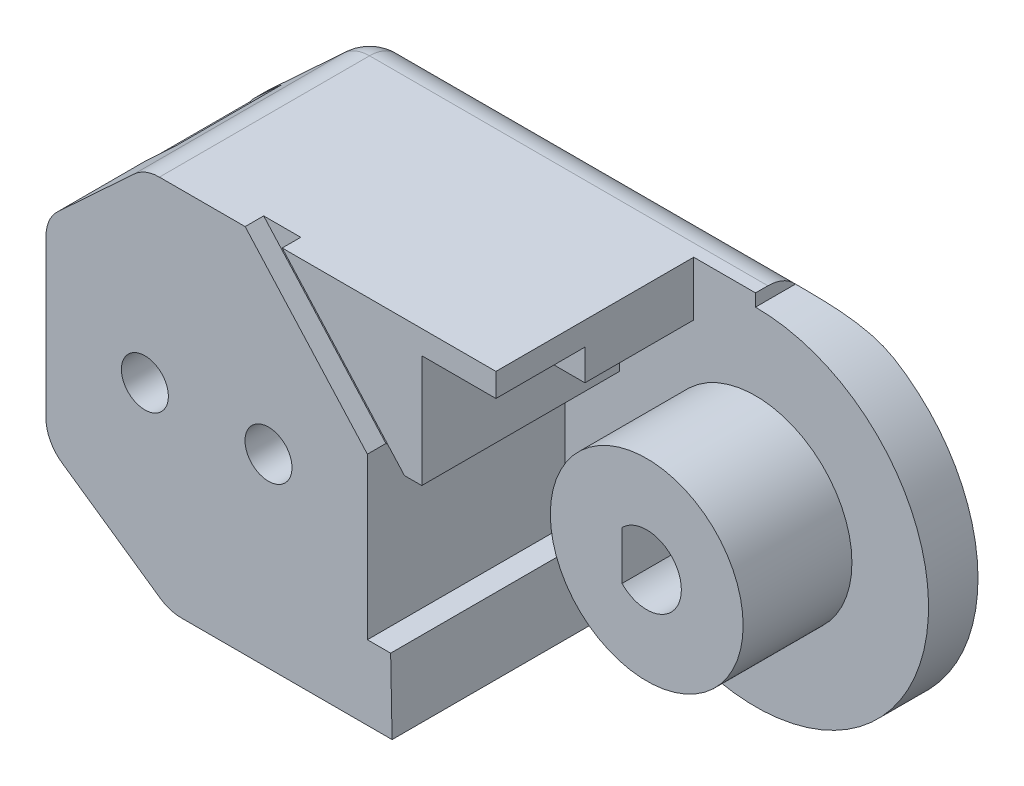
from build123d import *

# Parameters (mm, degrees)
BOSS_EXTRUDE1_DEPTH = 2
BOSS_EXTRUDE2_DEPTH = 8
SKETCH24_R          = 3.9
BOSS_EXTRUDE5_DEPTH = 4.4
SKETCH30_W          = 4.40861202
SKETCH30_H          = 1.324178481
CUT_EXTRUDE12_DEPTH = 16
CUT_EXTRUDE11_DEPTH = 23.928148639
FILLET1_R           = 1.5
SKETCH34_W          = 1.5
SKETCH34_H          = 1.5
CUT_EXTRUDE13_DEPTH = 8
SKETCH36_R          = 0.95
CUT_EXTRUDE15_DEPTH = 8
SKETCH37_R          = 2
CUT_EXTRUDE16_DEPTH = 4.5
SKETCH38_W          = 3
SKETCH38_H          = 1.25
CUT_EXTRUDE17_DEPTH = 3.6


with BuildPart() as part:
    # Sketch2 → Boss-Extrude1 (new body)
    with BuildSketch(Plane.XY):
        with BuildLine():
            Line((-2.5, 7.5), (-16.7, 7.5))
            Line((-16.7, 7.5), (-20.7, 3.793442666))
            Line((-20.7, 3.793442666), (-20.7, -4.031648778))
            Line((-20.7, -4.031648778), (-15.7, -7.5))
            Line((-15.7, -7.5), (-6.7, -7.5))
            Line((-6.7, -7.5), (-4.2, -5.6))
            ThreePointArc((-4.2, -5.6), (3.130495168, -6.260990337), (7, 0))
            ThreePointArc((7, 0), (4.949747468, 4.949747468), (0, 7))
            Line((0, 7), (0, 7.5))
            Line((0, 7.5), (-2.5, 7.5))
        make_face()
    extrude(amount=BOSS_EXTRUDE1_DEPTH)

    # Sketch4 → Boss-Extrude2 (add)
    with BuildSketch(Plane.XY.offset(2)):
        Polygon((-15.7, -7.5), (-6.7, -7.5), (-6.759079174, -4.5), (-7.7, -4.5), (-7.7, 2), (-5.5, 2), (-5.5, 5.3), (-2.5, 5.3), (-2.5, 7.5), (-16.7, 7.5), (-20.7, 3.793442666), (-20.7, -4.031648778), align=None)
    extrude(amount=BOSS_EXTRUDE2_DEPTH)

    # Sketch24 → Boss-Extrude5 (add)
    with BuildSketch(Plane.XY.offset(2)):
        Circle(SKETCH24_R)
    extrude(amount=BOSS_EXTRUDE5_DEPTH)

    # Sketch30 → Cut-Extrude12 (cut)
    with BuildSketch(Plane(origin=(-5.5, 0, 0), x_dir=(0, 0, -1), z_dir=(1, 0, 0))):
        with Locations((-4.20430601, 4.63791076)):
            Rectangle(SKETCH30_W, SKETCH30_H)
    extrude(amount=-CUT_EXTRUDE12_DEPTH, mode=Mode.SUBTRACT)

    # Sketch28 → Cut-Extrude11 (cut, through all)
    with BuildSketch(Plane.XY.offset(6.4)):
        with BuildLine():
            Line((-1, 0.979795897), (-1, -0.979795897))
            ThreePointArc((-1, -0.979795897), (1.4, 0), (-1, 0.979795897))
        make_face()
    extrude(amount=-CUT_EXTRUDE11_DEPTH, mode=Mode.SUBTRACT)

    # Fillet1
    # the kernel refuses this fillet: 1.5 mm, written as the material it takes off along each edge
    with BuildSketch(Plane(origin=(-15.230677435, -6, 1.5), x_dir=(-0.5699665637840448, -0.8216678867816415, 0), z_dir=(0, 0, -1))) as fillet1_piece_1_section:
        Polygon((0, 0), (FILLET1_R * 1.02, 0), (FILLET1_R * 1.02, -FILLET1_R * 0.319139344377), (FILLET1_R * 0.838101244517, -FILLET1_R * 0.58136589506), align=None)
    fillet1_piece_1 = extrude(amount=FILLET1_R * 1.02, mode=Mode.PRIVATE)
    fillet1_piece_1 = fillet1_piece_1 - Plane(origin=(-15.230677435, -6, 1.5), x_dir=(0.29860685961507855, 0.9543762064253388, 0), z_dir=(0, 0, -1)) * Sphere(FILLET1_R, mode=Mode.PRIVATE)
    add(fillet1_piece_1, mode=Mode.SUBTRACT)
    with BuildSketch(Plane(origin=(-16.11186344, 6, 1.5), x_dir=(-0.6796897201843015, 0.7334997506991983, 0), z_dir=(0, 0, -1))) as fillet1_piece_2_section:
        Polygon((0, 0), (FILLET1_R * 1.02, 0), (FILLET1_R * 1.02, FILLET1_R * 0.399932860855), (FILLET1_R * 0.748169745713, FILLET1_R * 0.693283514588), align=None)
    fillet1_piece_2 = extrude(amount=FILLET1_R * 1.02, mode=Mode.PRIVATE)
    fillet1_piece_2 = fillet1_piece_2 - Plane(origin=(-16.11186344, 6, 1.5), x_dir=(0.3650344157067945, -0.9309940254102596, 0), z_dir=(0, 0, -1)) * Sphere(FILLET1_R, mode=Mode.PRIVATE)
    add(fillet1_piece_2, mode=Mode.SUBTRACT)
    with BuildSketch(Plane(origin=(-19.2, 3.138411196, 1.5), x_dir=(-0.6796897201843015, 0.7334997506991983, 0), z_dir=(0, 0, -1))) as fillet1_piece_3_section:
        Polygon((0, 0), (FILLET1_R * 1.02, 0), (FILLET1_R * 1.02, -FILLET1_R * 0.445421399395), (FILLET1_R * 0.693283514588, -FILLET1_R * 0.748169745713), align=None)
    fillet1_piece_3 = extrude(amount=FILLET1_R * 1.02, mode=Mode.PRIVATE)
    fillet1_piece_3 = fillet1_piece_3 - Plane(origin=(-19.2, 3.138411196, 1.5), x_dir=(0.9164304993244992, -0.40019387789901173, 0), z_dir=(0, 0, -1)) * Sphere(FILLET1_R, mode=Mode.PRIVATE)
    add(fillet1_piece_3, mode=Mode.SUBTRACT)
    with BuildSketch(Plane(origin=(-19.2, -3.246599046, 1.5), x_dir=(-0.5699665637840448, -0.8216678867816415, 0), z_dir=(0, 0, -1))) as fillet1_piece_4_section:
        Polygon((0, 0), (FILLET1_R * 1.02, 0), (FILLET1_R * 1.02, FILLET1_R * 0.533833817771), (FILLET1_R * 0.58136589506, FILLET1_R * 0.838101244517), align=None)
    fillet1_piece_4 = extrude(amount=FILLET1_R * 1.02, mode=Mode.PRIVATE)
    fillet1_piece_4 = fillet1_piece_4 - Plane(origin=(-19.2, -3.246599046, 1.5), x_dir=(0.8859928227090906, 0.46369895202380795, 0), z_dir=(0, 0, -1)) * Sphere(FILLET1_R, mode=Mode.PRIVATE)
    add(fillet1_piece_4, mode=Mode.SUBTRACT)
    with BuildSketch(Plane(origin=(-15.230677435, -7.5, 0), x_dir=(0, 1, 0), z_dir=(1, 0, 0))) as fillet1_piece_5_section:
        with BuildLine():
            CenterArc((FILLET1_R, FILLET1_R), FILLET1_R, 180, 90)
            Line((0, FILLET1_R), (0, 0))
            Line((0, 0), (FILLET1_R, 0))
        make_face()
    fillet1_piece_5 = extrude(amount=12.280677435, mode=Mode.PRIVATE)
    fillet1_piece_5 = split(fillet1_piece_5, bisect_by=Plane(origin=(-9.092127217, -9.318016685, 0.3282266), z_dir=(-0.6050832675335577, 0.7961621941231027, 0)), keep=Keep.TOP, mode=Mode.PRIVATE)
    add(fillet1_piece_5, mode=Mode.SUBTRACT)
    with BuildSketch(Plane(origin=(3.75, 7.5, 0), x_dir=(0, 0, 1), z_dir=(-1, 0, 0))) as fillet1_piece_6:
        with BuildLine():
            CenterArc((FILLET1_R, -FILLET1_R), FILLET1_R, 90, 90)
            Line((0, -FILLET1_R), (0, 0))
            Line((0, 0), (FILLET1_R, 0))
        make_face()
    extrude(amount=19.86186344, mode=Mode.SUBTRACT)
    with BuildSketch(Plane(origin=(-17.13139802, 7.100249626, 0), x_dir=(0.6796897201843014, -0.7334997506991981, 0), z_dir=(-0.7334997506991983, -0.6796897201843015, 0))) as fillet1_piece_7:
        with BuildLine():
            CenterArc((FILLET1_R, FILLET1_R), FILLET1_R, 180, 90)
            Line((0, FILLET1_R), (0, 0))
            Line((0, 0), (FILLET1_R, 0))
        make_face()
    extrude(amount=4.21013989, mode=Mode.SUBTRACT)
    with BuildSketch(Plane(origin=(-20.054949846, -4.479100876, 0), x_dir=(0.5699665637840448, 0.8216678867816416, 0), z_dir=(0.8216678867816415, -0.5699665637840448, 0))) as fillet1_piece_8:
        with BuildLine():
            CenterArc((FILLET1_R, FILLET1_R), FILLET1_R, 180, 90)
            Line((0, FILLET1_R), (0, 0))
            Line((0, 0), (FILLET1_R, 0))
        make_face()
    extrude(amount=4.830811364, mode=Mode.SUBTRACT)
    with BuildSketch(Plane(origin=(-20.7, 3.138411196, 0), x_dir=(1, 0, 0), z_dir=(0, -1, 0))) as fillet1_piece_9:
        with BuildLine():
            CenterArc((FILLET1_R, FILLET1_R), FILLET1_R, 180, 90)
            Line((0, FILLET1_R), (0, 0))
            Line((0, 0), (FILLET1_R, 0))
        make_face()
    extrude(amount=6.385010242, mode=Mode.SUBTRACT)
    with BuildSketch(Plane(origin=(-15.7, -7.5, 1.5), x_dir=(1, 0, 0), z_dir=(0, 0, 1))) as fillet1_piece_10:
        with BuildLine():
            CenterArc((FILLET1_R * 0.312881710173, FILLET1_R), FILLET1_R, 235.252105822, 34.747894178)
            Line((-FILLET1_R * 0.257084853611, FILLET1_R * 0.178332113218), (0, 0))
            Line((0, 0), (FILLET1_R * 0.312881710173, 0))
        make_face()
    extrude(amount=9.673306413, mode=Mode.SUBTRACT)
    with BuildSketch(Plane(origin=(-20.7, -4.031648778, 1.5), x_dir=(0, 1, 0), z_dir=(0, 0, 1))) as fillet1_piece_11:
        with BuildLine():
            CenterArc((FILLET1_R * 0.523366488011, -FILLET1_R), FILLET1_R, 90, 55.252105822)
            Line((-FILLET1_R * 0.298301398771, -FILLET1_R * 0.430033436216), (0, 0))
            Line((0, 0), (FILLET1_R * 0.523366488011, 0))
        make_face()
    extrude(amount=10.46262433, mode=Mode.SUBTRACT)
    with BuildSketch(Plane(origin=(-20.7, 3.793442666, 1.5), x_dir=(0.7334997506991984, 0.6796897201843014, 0), z_dir=(0, 0, 1))) as fillet1_piece_12:
        with BuildLine():
            CenterArc((FILLET1_R * 0.436687646465, -FILLET1_R), FILLET1_R, 90, 47.18059856)
            Line((-FILLET1_R * 0.296812104234, -FILLET1_R * 0.320310279816), (0, 0))
            Line((0, 0), (FILLET1_R * 0.436687646465, 0))
        make_face()
    extrude(amount=10.137578674, mode=Mode.SUBTRACT)
    with BuildSketch(Plane(origin=(-16.7, 7.5, 1.5), x_dir=(1, 0, 0), z_dir=(0, 0, 1))) as fillet1_piece_13:
        with BuildLine():
            CenterArc((FILLET1_R * 0.392091040054, -FILLET1_R), FILLET1_R, 90, 42.81940144)
            Line((-FILLET1_R * 0.287598680131, -FILLET1_R * 0.266500249301), (0, 0))
            Line((0, 0), (FILLET1_R * 0.392091040054, 0))
        make_face()
    extrude(amount=9.9703414, mode=Mode.SUBTRACT)

    # Sketch34 → Cut-Extrude13 (cut, along a direction that is not the sketch's normal)
    with BuildSketch(Plane.XZ.offset(-2)):
        with Locations((-6.95, 10)):
            Rectangle(SKETCH34_W, SKETCH34_H)
    extrude(amount=-CUT_EXTRUDE13_DEPTH, dir=(0.6685833876565112, -0.7436371788377336, 0), mode=Mode.SUBTRACT)

    # Sketch36 → Cut-Extrude15 (cut)
    with BuildSketch(Plane.XY.offset(10)):
        with Locations((-11.7, 0)):
            Circle(SKETCH36_R)
        with Locations((-16.7, 0)):
            Circle(SKETCH36_R)
    extrude(amount=-CUT_EXTRUDE15_DEPTH, mode=Mode.SUBTRACT)

    # Sketch37 → Cut-Extrude16 (cut)
    with BuildSketch(Plane(origin=(0, 0, 0), x_dir=(-1, 0, 0), z_dir=(0, 0, -1))):
        with Locations((11.7, 0)):
            Circle(SKETCH37_R)
        with Locations((16.7, 0)):
            Circle(SKETCH37_R)
    extrude(amount=-CUT_EXTRUDE16_DEPTH, mode=Mode.SUBTRACT)

    # Sketch38 → Cut-Extrude17 (cut)
    with BuildSketch(Plane.XY.offset(10)):
        with Locations((-4, 5.925)):
            Rectangle(SKETCH38_W, SKETCH38_H)
    extrude(amount=-CUT_EXTRUDE17_DEPTH, mode=Mode.SUBTRACT)


solid = part.part
